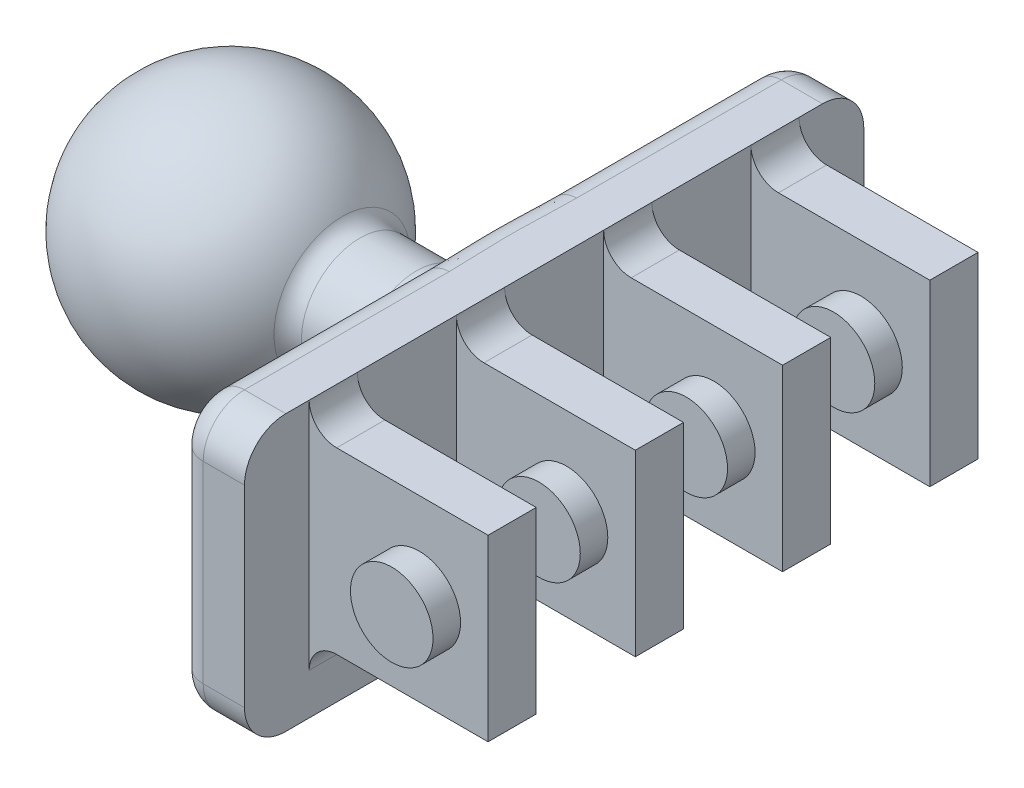
from build123d import *

# Parameters (mm, degrees)
SKETCH3_R                = 4.242640687
BOSS_EXTRUDE1_DEPTH      = 10
FILLET1_R                = 1.5
BOSS_EXTRUDE2_DEPTH      = 5
FILLET2_R                = 5
SKETCH5_W                = 13
SKETCH5_H                = 13
BOSS_EXTRUDE3_DEPTH      = 45
CUT_EXTRUDE4_REACH       = 48.503
SKETCH6_W                = 13
SKETCH6_H                = 4.7
SKETCH6_H_2              = 7.2
BOSS_EXTRUDE4_DEPTH      = 2
BOSS_EXTRUDE4_DEPTH_BACK = 5.5
SKETCH9_R                = 3
BOSS_EXTRUDE5_DEPTH      = 2
BOSS_EXTRUDE5_DEPTH_BACK = 5.5
SKETCH10_R               = 3
BOSS_EXTRUDE6_DEPTH      = 2
BOSS_EXTRUDE6_DEPTH_BACK = 5.5
SKETCH12_R               = 3
BOSS_EXTRUDE7_DEPTH      = 2
BOSS_EXTRUDE7_DEPTH_BACK = 5.5
SKETCH14_R               = 3
FILLET4_R                = 2
FILLET8_R                = 2


with BuildPart() as part:
    # Sketch1 → Revolve1 (revolve)
    with BuildSketch(Plane(origin=(0, 0, 0), x_dir=(1, 0, 0), z_dir=(0, 1, 0))):
        with BuildLine():
            Line((-9.5, 0), (8.5, 0))
            Line((8.5, 0), (8.5, 4.242640687))
            ThreePointArc((8.5, 4.242640687), (-2.179449472, 9.246621004), (-9.5, 0))
        make_face()
    revolve(axis=Axis((-9.5, 0, 0), (1, 0, 0)))

    # Sketch3 → Boss-Extrude1 (add)
    with BuildSketch(Plane(origin=(8.5, 0, 0), x_dir=(0, 0, -1), z_dir=(1, 0, 0))):
        Circle(SKETCH3_R)
    extrude(amount=BOSS_EXTRUDE1_DEPTH)

    # Fillet1
    fillet1_edges = [part.edges().sort_by_distance(p)[0] for p in [
        (8.5, 0, 4.242640687),
    ]]
    fillet(fillet1_edges, radius=FILLET1_R)

    # Sketch4 → Boss-Extrude2 (add)
    with BuildSketch(Plane(origin=(18.5, 0, 0), x_dir=(0, 0, -1), z_dir=(1, 0, 0))):
        with BuildLine():
            Line((19.5, -10), (-19.5, -10))
            ThreePointArc((-19.5, -10), (-21.621320344, -9.121320344), (-22.5, -7))
            Line((-22.5, -7), (-22.5, 7))
            ThreePointArc((-22.5, 7), (-21.621320344, 9.121320344), (-19.5, 10))
            Line((-19.5, 10), (19.5, 10))
            ThreePointArc((19.5, 10), (21.621320344, 9.121320344), (22.5, 7))
            Line((22.5, 7), (22.5, -7))
            ThreePointArc((22.5, -7), (21.621320344, -9.121320344), (19.5, -10))
        make_face()
    extrude(amount=BOSS_EXTRUDE2_DEPTH)

    # Fillet2
    fillet2_edges = [part.edges().sort_by_distance(p)[0] for p in [
        (18.5, 0, 4.242640687),
    ]]
    fillet(fillet2_edges, radius=FILLET2_R)

    # Sketch5 → Boss-Extrude3 (add, through all)
    with BuildSketch(Plane.XY.offset(22.5)):
        with Locations((30, 1.5)):
            Rectangle(SKETCH5_W, SKETCH5_H)
    extrude(amount=-BOSS_EXTRUDE3_DEPTH)

    # Sketch6 → Cut-Extrude4 (cut, up to next)
    with BuildSketch(Plane(origin=(0, 8, 0), x_dir=(1, 0, 0), z_dir=(0, 1, 0)), mode=Mode.PRIVATE) as cut_extrude4_sk1:
        with Locations((30, -20.15)):
            Rectangle(SKETCH6_W, SKETCH6_H)
    cut_extrude4_tool1 = extrude(cut_extrude4_sk1.sketch, amount=-CUT_EXTRUDE4_REACH, mode=Mode.PRIVATE) & part.part
    # Sketch6 → Cut-Extrude4 (cut, up to next)
    with BuildSketch(Plane(origin=(0, 8, 0), x_dir=(1, 0, 0), z_dir=(0, 1, 0)), mode=Mode.PRIVATE) as cut_extrude4_sk2:
        with Locations((30, -10.7)):
            Rectangle(SKETCH6_W, SKETCH6_H_2)
    cut_extrude4_tool2 = extrude(cut_extrude4_sk2.sketch, amount=-CUT_EXTRUDE4_REACH, mode=Mode.PRIVATE) & part.part
    # Sketch6 → Cut-Extrude4 (cut, up to next)
    with BuildSketch(Plane(origin=(0, 8, 0), x_dir=(1, 0, 0), z_dir=(0, 1, 0)), mode=Mode.PRIVATE) as cut_extrude4_sk3:
        with Locations((30, 0)):
            Rectangle(SKETCH6_W, SKETCH6_H_2)
    cut_extrude4_tool3 = extrude(cut_extrude4_sk3.sketch, amount=-CUT_EXTRUDE4_REACH, mode=Mode.PRIVATE) & part.part
    # Sketch6 → Cut-Extrude4 (cut, up to next)
    with BuildSketch(Plane(origin=(0, 8, 0), x_dir=(1, 0, 0), z_dir=(0, 1, 0)), mode=Mode.PRIVATE) as cut_extrude4_sk4:
        with Locations((30, 10.7)):
            Rectangle(SKETCH6_W, SKETCH6_H_2)
    cut_extrude4_tool4 = extrude(cut_extrude4_sk4.sketch, amount=-CUT_EXTRUDE4_REACH, mode=Mode.PRIVATE) & part.part
    # Sketch6 → Cut-Extrude4 (cut, up to next)
    with BuildSketch(Plane(origin=(0, 8, 0), x_dir=(1, 0, 0), z_dir=(0, 1, 0)), mode=Mode.PRIVATE) as cut_extrude4_sk5:
        with Locations((30, 20.15)):
            Rectangle(SKETCH6_W, SKETCH6_H)
    cut_extrude4_tool5 = extrude(cut_extrude4_sk5.sketch, amount=-CUT_EXTRUDE4_REACH, mode=Mode.PRIVATE) & part.part
    add(cut_extrude4_tool1.solids().sort_by_distance((30, 8, 20.15))[0], mode=Mode.SUBTRACT)
    add(cut_extrude4_tool2.solids().sort_by_distance((30, 8, 10.7))[0], mode=Mode.SUBTRACT)
    add(cut_extrude4_tool3.solids().sort_by_distance((30, 8, 0))[0], mode=Mode.SUBTRACT)
    add(cut_extrude4_tool4.solids().sort_by_distance((30, 8, -10.7))[0], mode=Mode.SUBTRACT)
    add(cut_extrude4_tool5.solids().sort_by_distance((30, 8, -20.15))[0], mode=Mode.SUBTRACT)

    # Sketch9 → Boss-Extrude4 (add, two sides: drawn at the far end of the back side and taken through both)
    with BuildSketch(Plane.XY.offset(17.8).offset(-BOSS_EXTRUDE4_DEPTH_BACK)):
        with Locations((31.5, 1.5)):
            Circle(SKETCH9_R)
    extrude(amount=BOSS_EXTRUDE4_DEPTH + BOSS_EXTRUDE4_DEPTH_BACK)

    # Sketch10 → Boss-Extrude5 (add, two sides: drawn at the far end of the back side and taken through both)
    with BuildSketch(Plane.XY.offset(7.1).offset(-BOSS_EXTRUDE5_DEPTH_BACK)):
        with Locations((31.5, 1.5)):
            Circle(SKETCH10_R)
    extrude(amount=BOSS_EXTRUDE5_DEPTH + BOSS_EXTRUDE5_DEPTH_BACK)

    # Sketch12 → Boss-Extrude6 (add, two sides: drawn at the far end of the back side and taken through both)
    with BuildSketch(Plane.XY.offset(-3.6).offset(-BOSS_EXTRUDE6_DEPTH_BACK)):
        with Locations((31.5, 1.5)):
            Circle(SKETCH12_R)
    extrude(amount=BOSS_EXTRUDE6_DEPTH + BOSS_EXTRUDE6_DEPTH_BACK)

    # Sketch14 → Boss-Extrude7 (add, two sides: drawn at the far end of the back side and taken through both)
    with BuildSketch(Plane.XY.offset(-14.3).offset(-BOSS_EXTRUDE7_DEPTH_BACK)):
        with Locations((31.5, 1.5)):
            Circle(SKETCH14_R)
    extrude(amount=BOSS_EXTRUDE7_DEPTH + BOSS_EXTRUDE7_DEPTH_BACK)

    # Fillet4
    fillet4_edges = [part.edges().sort_by_distance(p)[0] for p in [
        (23.5, -5, -16.05),
        (23.5, -5, -5.35),
        (23.5, -5, 5.35),
        (23.5, -5, 16.05),
        (23.5, 8, -16.05),
        (23.5, 8, -5.35),
        (23.5, 8, 5.35),
        (23.5, 8, 16.05),
    ]]
    fillet(fillet4_edges, radius=FILLET4_R - 0.0001)  # a hair under: the kernel refuses the full size

    # Fillet8
    fillet8_edges = [part.edges().sort_by_distance(p)[0] for p in [
        (18.5, -9.121320344, 21.621320344),
        (18.5, -10, 0),
        (18.5, -9.121320344, -21.621320344),
        (18.5, 0, -22.5),
        (18.5, 9.121320344, -21.621320344),
        (18.5, 10, 0),
        (18.5, 9.121320344, 21.621320344),
        (18.5, 0, 22.5),
    ]]
    fillet(fillet8_edges, radius=FILLET8_R)


solid = part.part
